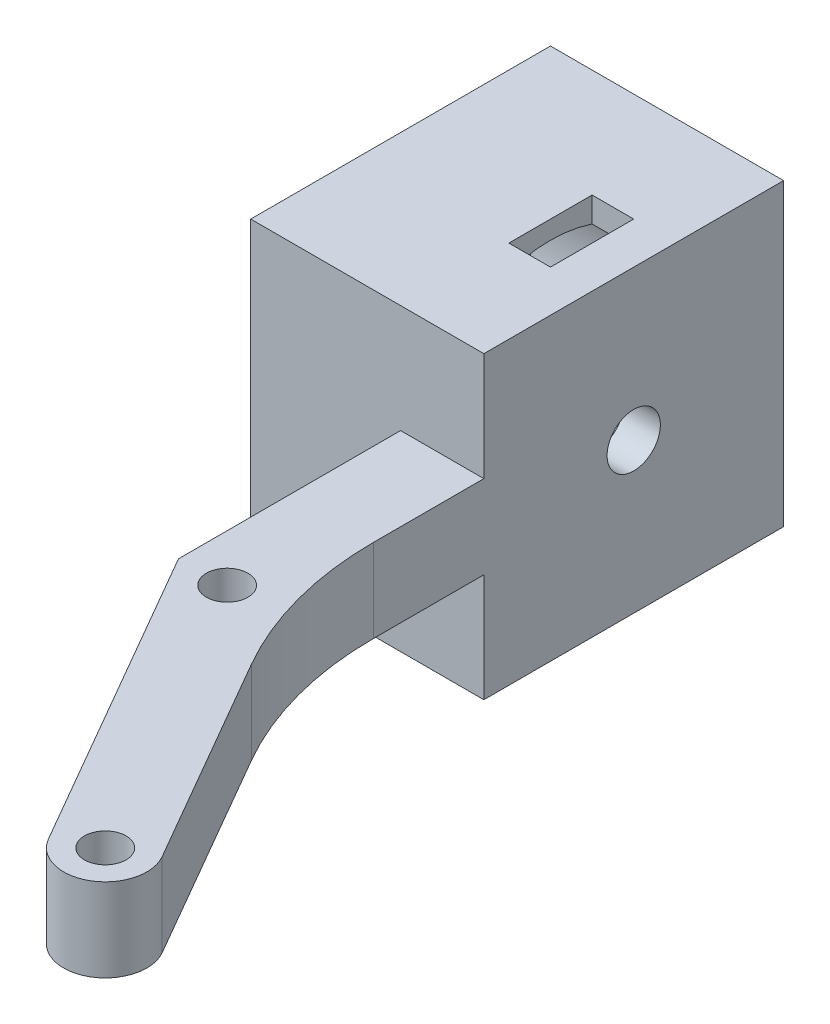
from build123d import *

# Parameters (mm, degrees)
SKETCH1_R               = 1.5875
BOSS_EXTRUDE1_DEPTH     = 22.86
TOP_CUT_DEPTH           = 8.255
BOTTOM_CUT_DEPTH        = 8.255
SKETCH5_R               = 10.033
CUT_EXTRUDE1_DEPTH      = 14.986
SKETCH7_R               = 2.032
CUT_EXTRUDE2_DEPTH      = 49.946539324
CUT_EXTRUDE3_REACH      = 50.947
CUT_EXTRUDE3_END_RADIUS = 10.033
SKETCH8_W               = 3.175
SKETCH8_H               = 6.35
FILLET1_R               = 25.4


with BuildPart() as part:
    # Sketch1 → Boss-Extrude1 (new body)
    with BuildSketch(Plane(origin=(0, 0, 0), x_dir=(1, 0, 0), z_dir=(0, 1, 0))):
        with BuildLine():
            Line((-6.35, -14.401477372), (-6.35, 2.54))
            Line((-6.35, 2.54), (-17.78, 2.54))
            Line((-17.78, 2.54), (-17.78, 25.4))
            Line((-17.78, 25.4), (0, 25.4))
            Line((0, 25.4), (0, -12.7))
            Line((0, -12.7), (12.7, -34.697045256))
            ThreePointArc((12.7, -34.697045256), (11.537869343, -39.034175913), (7.200738686, -37.872045256))
            Line((7.200738686, -37.872045256), (-6.35, -14.401477372))
        make_face()
        with Locations((9.950369343, -36.284545256)):
            Circle(SKETCH1_R, mode=Mode.SUBTRACT)
        with Locations((-2.749630657, -14.2875)):
            Circle(SKETCH1_R, mode=Mode.SUBTRACT)
    extrude(amount=BOSS_EXTRUDE1_DEPTH)

    # Sketch2 → Top Cut (cut)
    with BuildSketch(Plane(origin=(0, 22.86, 0), x_dir=(1, 0, 0), z_dir=(0, 1, 0))):
        Polygon((-6.35, -14.401477372), (8.788238686, -40.621675913), (14.2875, -37.446675913), (0, -12.7), (0, 2.54), (-6.35, 2.54), align=None)
    extrude(amount=-TOP_CUT_DEPTH, mode=Mode.SUBTRACT)

    # Sketch4 → Bottom Cut (cut)
    with BuildSketch(Plane.XZ):
        Polygon((-6.35, -2.54), (-6.35, 14.401477372), (8.788238686, 40.621675913), (14.2875, 37.446675913), (0, 12.7), (0, -2.54), align=None)
    extrude(amount=-BOTTOM_CUT_DEPTH, mode=Mode.SUBTRACT)

    # Sketch5 → Cut-Extrude1 (cut)
    with BuildSketch(Plane.ZY.offset(17.78)):
        with Locations((-13.97, 11.43)):
            Circle(SKETCH5_R)
    extrude(amount=-CUT_EXTRUDE1_DEPTH, mode=Mode.SUBTRACT)

    # Sketch7 → Cut-Extrude2 (cut, through all)
    with BuildSketch(Plane(origin=(0, 0, 0), x_dir=(0, 0, -1), z_dir=(1, 0, 0))):
        with Locations((13.97, 11.43)):
            Circle(SKETCH7_R)
    extrude(amount=-CUT_EXTRUDE2_DEPTH, mode=Mode.SUBTRACT)

    # Cut-Extrude3: up to this cylinder (the profile starts outside it)
    cut_extrude3_end = Plane(origin=(-4.7625, 11.43, -13.97), z_dir=(-1, 0, 0)) * Cylinder(CUT_EXTRUDE3_END_RADIUS, 122.96, mode=Mode.PRIVATE)
    # Sketch8 → Cut-Extrude3 (cut, up to the surface)
    with BuildSketch(Plane(origin=(0, 22.86, 0), x_dir=(1, 0, 0), z_dir=(0, 1, 0)), mode=Mode.PRIVATE) as cut_extrude3_sk1:
        with Locations((-4.7625, 13.97)):
            Rectangle(SKETCH8_W, SKETCH8_H)
    cut_extrude3_tool1 = extrude(cut_extrude3_sk1.sketch, amount=-CUT_EXTRUDE3_REACH, mode=Mode.PRIVATE) - cut_extrude3_end
    add(cut_extrude3_tool1.solids().sort_by_distance((-4.7625, 22.86, -13.97))[0], mode=Mode.SUBTRACT)

    # Fillet1
    fillet1_edges = [part.edges().sort_by_distance(p)[0] for p in [
        (0, 11.43, 12.7),
    ]]
    fillet(fillet1_edges, radius=FILLET1_R)


solid = part.part
